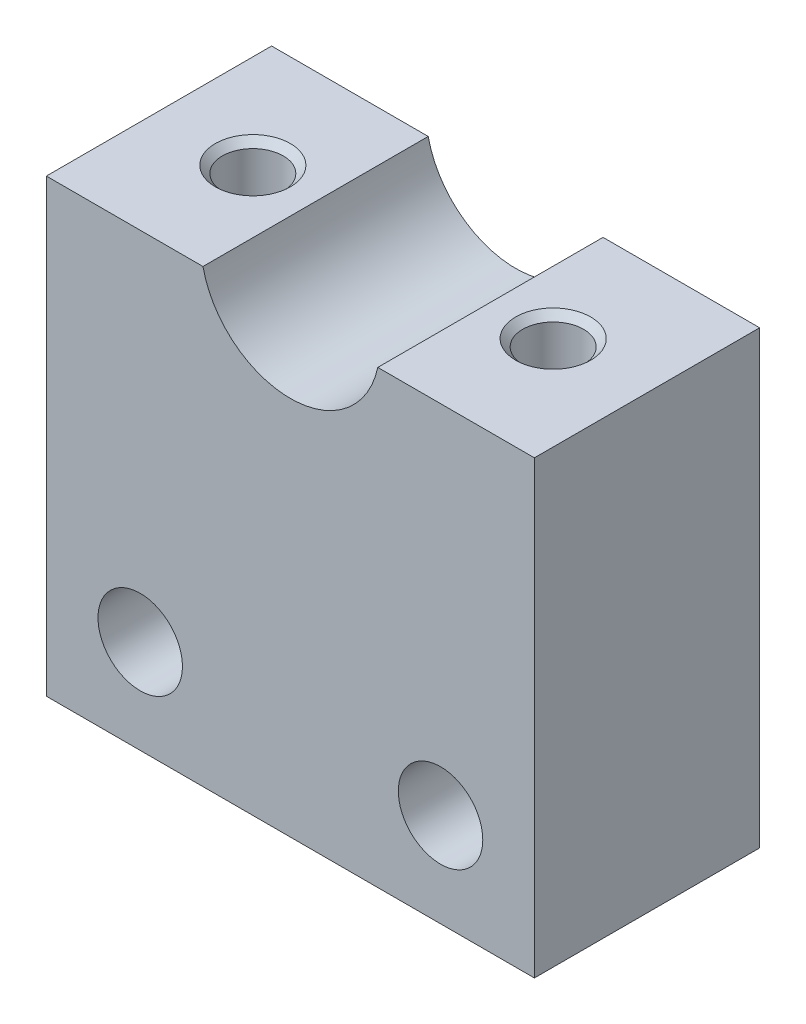
from build123d import *

# Parameters (mm, degrees)
SKETCH1_W                  = 26
SKETCH1_H                  = 24
BOSS_EXTRUDE1_DEPTH        = 12
CUT_EXTRUDE1_DEPTH         = 30.816103032
M3_CLEARANCE_HOLE1_D       = 3.242
M3_CLEARANCE_HOLE1_DEPTH   = 6.064115214
M3_CLEARANCE_HOLE1_TIP     = 0.935884786
F_4_5_4_5_DIAMETER_HOLE1_D = 4.5
CHAMFER1_SIZE              = 0.379


with BuildPart() as part:
    # Sketch1 → Boss-Extrude1 (new body)
    with BuildSketch(Plane.XY.offset(6)):
        with Locations((0, 12)):
            Rectangle(SKETCH1_W, SKETCH1_H)
    extrude(amount=-BOSS_EXTRUDE1_DEPTH)

    # Sketch2 → Cut-Extrude1 (cut, through all)
    with BuildSketch(Plane(origin=(0, 0, -6), x_dir=(-1, 0, 0), z_dir=(0, 0, -1))):
        with BuildLine():
            Line((4.656329697, 24), (-4.656329697, 24))
            ThreePointArc((-4.656329697, 24), (0, 20.2375), (4.656329697, 24))
        make_face()
    extrude(amount=-CUT_EXTRUDE1_DEPTH, mode=Mode.SUBTRACT)

    # M3 Clearance Hole1
    with Locations(Plane(origin=(0, 24, 0), x_dir=(1, 0, 0), z_dir=(0, 1, 0))):
        with Locations((8, 0), (-8, 0)):
            Hole(M3_CLEARANCE_HOLE1_D / 2, depth=M3_CLEARANCE_HOLE1_DEPTH)
            with Locations((0, 0, -(M3_CLEARANCE_HOLE1_DEPTH + M3_CLEARANCE_HOLE1_TIP / 2))):  # 120° drill point
                Cone(0, M3_CLEARANCE_HOLE1_D / 2, M3_CLEARANCE_HOLE1_TIP, mode=Mode.SUBTRACT)

    # Ø4.5 (4.5) Diameter Hole1 (through all)
    with Locations(Plane.XY.offset(6)):
        with Locations((8, 5), (-8, 5)):
            Hole(F_4_5_4_5_DIAMETER_HOLE1_D / 2)

    # Chamfer1
    chamfer1_edges = [part.edges().sort_by_distance(p)[0] for p in [
        (-6.379, 24, 0),
        (9.621, 24, 0),
    ]]
    chamfer(chamfer1_edges, length=CHAMFER1_SIZE)


solid = part.part
